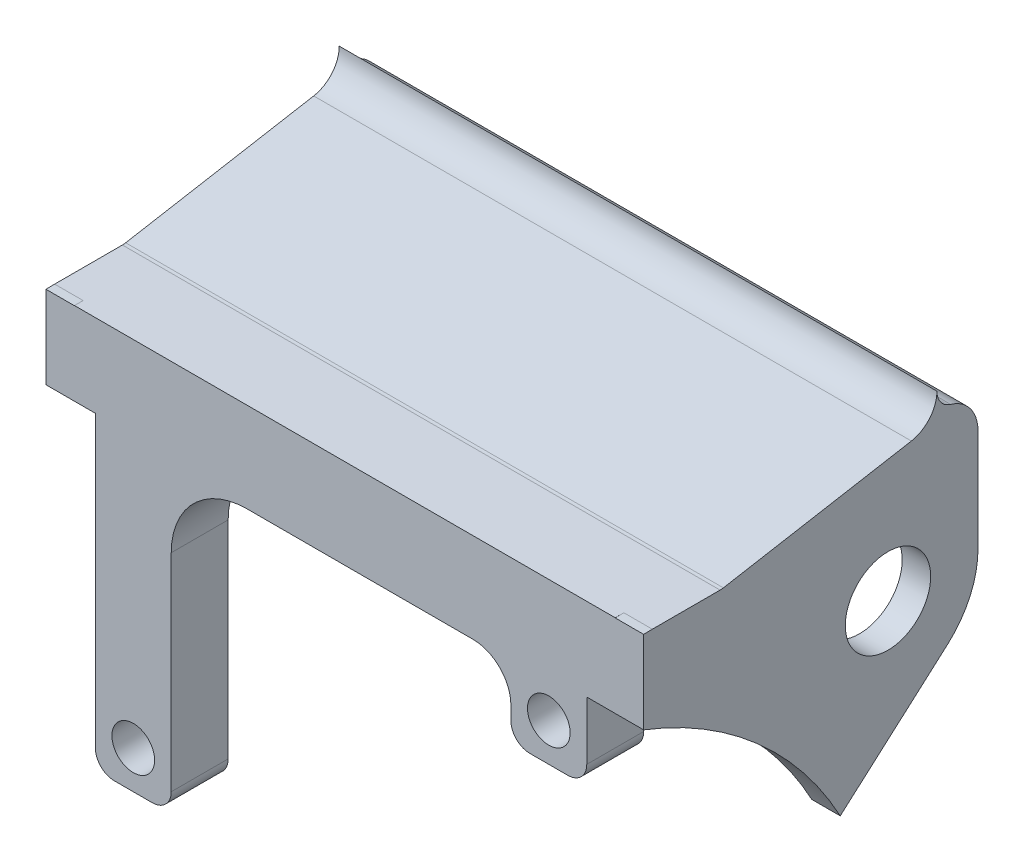
from build123d import *

# Parameters (mm, degrees)
SKETCH1_R            = 1.125
BOSS_EXTRUDE1_DEPTH  = 3
BOSS_EXTRUDE2_DEPTH  = 3
SKETCH4_R            = 2.25
BOSS_EXTRUDE4_DEPTH  = 1.5
BOSS_EXTRUDE5_START  = 28.5
BOSS_EXTRUDE5_DEPTH  = 28.5
SKETCH8_W            = 28.5
SKETCH8_H            = 3
BOSS_EXTRUDE13_DEPTH = 2.443258406
FILLET1_R            = 2
FILLET2_R            = 1


with BuildPart() as part:
    # Sketch1 → Boss-Extrude1 (new body)
    with BuildSketch(Plane.XY):
        with BuildLine():
            Line((-13.15, 3.327838927), (-13.15, -13.87167957))
            ThreePointArc((-13.15, -13.87167957), (-12.857106781, -14.578786352), (-12.15, -14.87167957))
            Line((-12.15, -14.87167957), (-10.15, -14.87167957))
            ThreePointArc((-10.15, -14.87167957), (-9.442893219, -14.578786352), (-9.15, -13.87167957))
            Line((-9.15, -13.87167957), (-9.15, -2.961805456))
            ThreePointArc((-9.15, -2.961805456), (-7.978427125, -0.133378332), (-5.15, 1.038194544))
            Line((-5.15, 1.038194544), (6.75, 1.038194544))
            ThreePointArc((6.75, 1.038194544), (8.164213562, 0.452408106), (8.75, -0.961805456))
            Line((8.75, -0.961805456), (8.75, -1.67167957))
            ThreePointArc((8.75, -1.67167957), (9.042893219, -2.378786352), (9.75, -2.67167957))
            Line((9.75, -2.67167957), (11.75, -2.67167957))
            ThreePointArc((11.75, -2.67167957), (12.457106781, -2.378786352), (12.75, -1.67167957))
            Line((12.75, -1.67167957), (12.75, 3.327838927))
            Line((12.75, 3.327838927), (-13.15, 3.327838927))
        make_face()
        with Locations((-11.15, -12.87167957)):
            Circle(SKETCH1_R, mode=Mode.SUBTRACT)
        with Locations((10.75, -0.67167957)):
            Circle(SKETCH1_R, mode=Mode.SUBTRACT)
    extrude(amount=BOSS_EXTRUDE1_DEPTH)


with BuildPart() as body_2:
    # Sketch2 → Boss-Extrude2 (new body)
    with BuildSketch(Plane(origin=(12.75, 0, 0), x_dir=(0, 0, -1), z_dir=(1, 0, 0))):
        with BuildLine():
            Line((0, -0.048364378), (0, 3.327838927))
            Line((0, 3.327838927), (-3, 3.327838927))
            Line((-3, 3.327838927), (-3, 1.403074886))
            ThreePointArc((-3, 1.403074886), (-1.469520823, 0.740353088), (0, -0.048364378))
        make_face()
    boss_extrude2 = extrude(amount=BOSS_EXTRUDE2_DEPTH)


with BuildPart() as body_3:
    # Sketch4 → Boss-Extrude4 (new body)
    with BuildSketch(Plane.ZY.offset(-15.75)):
        with BuildLine():
            Line((-14.619360276, 0.851097333), (-14.619360276, 6.251097333))
            ThreePointArc((-14.619360276, 6.251097333), (-14.218539822, 7.452190493), (-13.176735496, 8.171860948))
            ThreePointArc((-13.176735496, 8.171860948), (-12.655081911, 8.532697951), (-12.455426242, 9.134747301))
            ThreePointArc((-12.455426242, 9.134747301), (-12.072768819, 8.089517784), (-11.108469635, 7.533593094))
            Line((-11.108469635, 7.533593094), (-1.19901898, 5.78628958))
            ThreePointArc((-1.19901898, 5.78628958), (-1.112526545, 5.774902634), (-1.025370803, 5.771097333))
            Line((-1.025370803, 5.771097333), (2.544576896, 5.771097333))
            Line((2.544576896, 5.771097333), (3, 5.763220708))
            Line((3, 5.763220708), (3, 1.403074886))
            ThreePointArc((3, 1.403074886), (-2.995287542, -2.222261242), (-7.359906948, -7.702829842))
            Line((-7.359906948, -7.702829842), (-13.016847846, -2.703672769))
            ThreePointArc((-13.016847846, -2.703672769), (-14.200215671, -1.098546004), (-14.619360276, 0.851097333))
        make_face()
        with Locations((-9.875423105, 0.851097333)):
            Circle(SKETCH4_R, mode=Mode.SUBTRACT)
    boss_extrude4 = extrude(amount=BOSS_EXTRUDE4_DEPTH)

    # Sketch5 → Boss-Extrude5 (add)
    with BuildSketch(Plane.ZY.offset(-14.25).offset(BOSS_EXTRUDE5_START)):
        with BuildLine():
            Line((0, 4.911114143), (0, 5.771097333))
            Line((0, 5.771097333), (-1.025370803, 5.771097333))
            ThreePointArc((-1.025370803, 5.771097333), (-1.112526545, 5.774902634), (-1.19901898, 5.78628958))
            Line((-1.19901898, 5.78628958), (-11.108470351, 7.533589032))
            ThreePointArc((-11.108470351, 7.533589032), (-12.072769301, 8.089518357), (-12.455426242, 9.134747301))
            ThreePointArc((-12.455426242, 9.134747301), (-12.655081911, 8.532697951), (-13.176735496, 8.171860948))
            ThreePointArc((-13.176735496, 8.171860948), (-14.218539822, 7.452190493), (-14.619360276, 6.251097333))
            Line((-14.619360276, 6.251097333), (-14.619360276, 5.411114143))
            ThreePointArc((-14.619360276, 5.411114143), (-14.472913667, 5.057560752), (-14.119360276, 4.911114143))
            Line((-14.119360276, 4.911114143), (0, 4.911114143))
        make_face()
    extrude(amount=-BOSS_EXTRUDE5_DEPTH)


with BuildPart() as part_1:
    add(part.part)

    # Mirror4: Boss-Extrude2, Boss-Extrude4 across plane
    add(boss_extrude2.mirror(Plane(origin=(0, 0, 0), x_dir=(0, 0, 1), z_dir=(1, 0, 0))))
    add(boss_extrude4.mirror(Plane(origin=(0, 0, 0), x_dir=(0, 0, 1), z_dir=(1, 0, 0))))

    add(body_2.part)  # Boss-Extrude13 merges body 2

    add(body_3.part)  # Boss-Extrude13 merges body 3
    # Sketch8 → Boss-Extrude13 (add)
    with BuildSketch(Plane(origin=(0, 3.327838927, 0), x_dir=(1, 0, 0), z_dir=(0, 1, 0))):
        with Locations((0, -1.5)):
            Rectangle(SKETCH8_W, SKETCH8_H)
    extrude(amount=BOSS_EXTRUDE13_DEPTH)

    # Fillet1
    fillet1_edges = [part_1.edges().sort_by_distance(p)[0] for p in [
        (0, 4.911114143, 0),
    ]]
    fillet(fillet1_edges, radius=FILLET1_R)

    # Fillet2
    # the kernel refuses this fillet: 1 mm, written as the material it adds along each edge
    with BuildSketch(Plane(origin=(14.25, -2.548364378, 0), x_dir=(0, 0, -1), z_dir=(0, 1, 0))) as fillet2_piece_1_section:
        with BuildLine():
            CenterArc((FILLET2_R, FILLET2_R), FILLET2_R, 180, 90)
            Line((0, FILLET2_R), (0, 0))
            Line((0, 0), (FILLET2_R, 0))
        make_face()
    fillet2_piece_1 = extrude(amount=7.959478521, mode=Mode.PRIVATE)
    fillet2_piece_1 = fillet2_piece_1 - Plane(origin=(13.964239779, -17.148902667, 10.124576895), x_dir=(0, 0.9335275549954881, -0.35850565415924185), z_dir=(1, 0, 0)) * Cylinder(19.872983346, 20, mode=Mode.PRIVATE)
    add(fillet2_piece_1)
    with BuildSketch(Plane(origin=(-14.25, -2.548364378, 0), x_dir=(1, 0, 0), z_dir=(0, 1, 0))) as fillet2_piece_2_section:
        with BuildLine():
            CenterArc((FILLET2_R, FILLET2_R), FILLET2_R, 180, 90)
            Line((0, FILLET2_R), (0, 0))
            Line((0, 0), (FILLET2_R, 0))
        make_face()
    fillet2_piece_2 = extrude(amount=7.959478521, mode=Mode.PRIVATE)
    fillet2_piece_2 = fillet2_piece_2 - Plane(origin=(-13.964240251, -17.148902667, 10.124576895), x_dir=(0, 0.9335275549956203, -0.3585056541588977), z_dir=(1, 0, 0)) * Cylinder(19.872983346, 20, mode=Mode.PRIVATE)
    add(fillet2_piece_2)


solid = part_1.part
